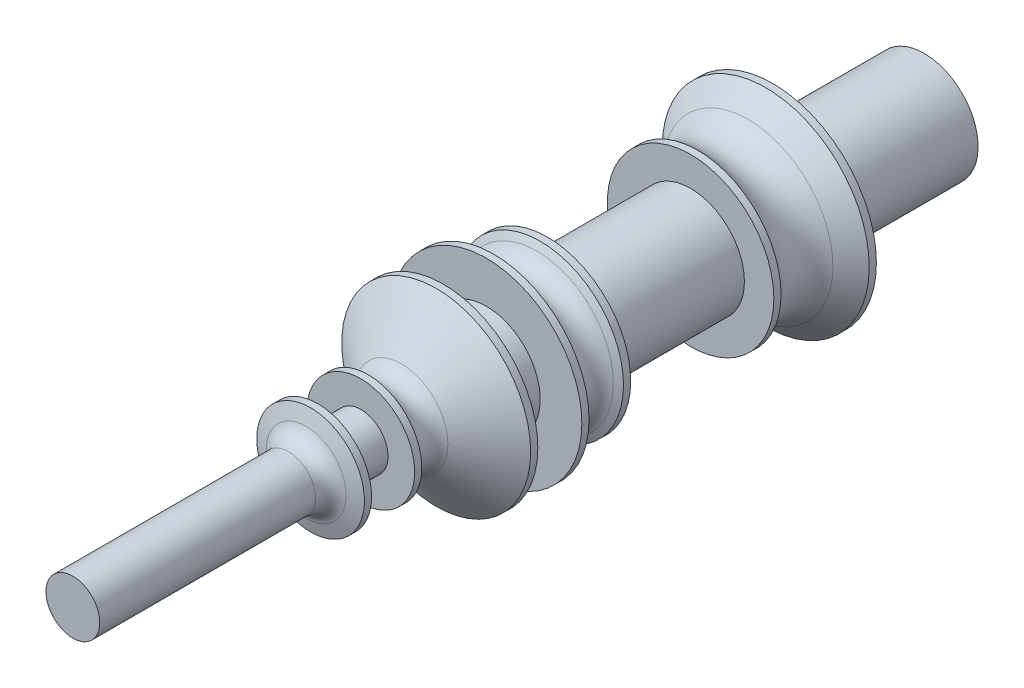
from build123d import *

# Parameters (mm, degrees)
SKETCH1_R           = 14.999999999999998
BOSS_EXTRUDE1_DEPTH = 235.00000000000006
FILLET2_R           = 10
SKETCH4_W           = 104.26000000000013
SKETCH4_H           = 22.69462593232808
SKETCH10_R          = 15
BOSS_EXTRUDE2_DEPTH = 10
SCALE1_SCALE        = 1.9329
BOSS_EXTRUDE3_START = 40
SKETCH11_R          = 28.993500000000004
BOSS_EXTRUDE3_DEPTH = 40
FILLET3_R           = 10
FILLET5_R           = 10
FILLET6_R           = 10
FILLET7_R           = 10
SCALE2_SCALE        = 1.5
SKETCH12_R          = 43.49025000000001
CUT_EXTRUDE1_DEPTH  = 33.369805
SKETCH13_R          = 43.49025000000001
CUT_EXTRUDE2_DEPTH  = 20


with BuildPart() as part:
    # Sketch1 → Boss-Extrude1 (new body)
    with BuildSketch(Plane.XY):
        Circle(SKETCH1_R)
    extrude(amount=BOSS_EXTRUDE1_DEPTH)

    # Sketch2 → Revolve1 (revolve)
    with BuildSketch(Plane(origin=(0, 0, 0), x_dir=(1, 0, 0), z_dir=(0, 1, 0))):
        Polygon((0, -112.54820823836592), (0, -13.4987966999347), (11.119928350948882, -13.4987966999347), (11.119928350948882, -39.9), (15.000000000000005, -39.9), (28.84535837615048, -39.89999999999999), (28.845358376150482, -41.9), (16.269055666837332, -53.905209320131334), (23.203846346706012, -60.84), (23.203846346706015, -62.84), (7.5, -62.84), (7.4999999999999964, -102.74), (23.203846346706012, -102.74), (23.203846346706012, -104.74), (7.499999999999994, -112.54820823836592), align=None)
    revolve(axis=Axis((0, 0, 112.54820823836592), (0, 0, -1)))

    # Fillet2
    # the kernel refuses this fillet: 10 mm, written as the material it adds along each edge
    with BuildSketch(Plane(origin=(0, 0, 53.905209320131334), x_dir=(1, 0, 0), z_dir=(0, 1, 0))) as fillet2_piece_1:
        with BuildLine():
            CenterArc((30.57076321680232, -0.17250291395021122), FILLET2_R, 133.66910726980632, 88.8805373351795)
            Line((23.665838203316056, 7.060892592873103), (23.527739703046333, 7.205560503009572))
            Line((23.527739703046333, 7.205560503009572), (16.130957166567608, 0.1446679101364694))
            Line((16.130957166567608, 0.1446679101364694), (16.127634310600023, -0.14142135623730923))
            ThreePointArc((16.127634310600023, -0.14142135623730923), (19.595029650534364, -3.608816696171644), (23.05650800930409, -7.070036435187042))
            Line((23.05650800930409, -7.070036435187042), (23.203846346706015, -6.934790679868669))
        make_face()
    revolve(axis=Axis((0, 0, 53.905209320131334), (0, 0, -1)))
    with BuildSketch(Plane(origin=(0, 0, 108.81908605423119), x_dir=(1, 2.8e-16, 0), z_dir=(-2.8e-16, 1, 0))) as fillet2_piece_2:
        with BuildLine():
            CenterArc((14.999999999999998 + FILLET2_R, -FILLET2_R * 0.619575560585), FILLET2_R, 116.43731334282423, 63.56268665717579)
            Line((14.999999999999998 + FILLET2_R * 0.554781591202, FILLET2_R * 0.275846445214), (14.999999999999998 + FILLET2_R * 0.545877223026, FILLET2_R * 0.293754885329))
            Line((14.999999999999998 + FILLET2_R * 0.545877223026, FILLET2_R * 0.293754885329), (14.999999999999998 - FILLET2_R * 0.02, FILLET2_R * 0.0123915112117))
            Line((14.999999999999998 - FILLET2_R * 0.02, FILLET2_R * 0.0123915112117), (14.999999999999998 - FILLET2_R * 0.02, -FILLET2_R * 0.619575560585))
            Line((14.999999999999998 - FILLET2_R * 0.02, -FILLET2_R * 0.619575560585), (15, -FILLET2_R * 0.619575560585))
        make_face()
    revolve(axis=Axis((0, 0, 108.81908605423119), (0, 0, -1)))

    # Sketch3 → Revolve2 (revolve)
    with BuildSketch(Plane(origin=(0, 0, 0), x_dir=(0, 0, -1), z_dir=(1, 0, 0)), mode=Mode.PRIVATE) as revolve2_sk:
        Polygon((-130.74, 0), (-130.73999999999998, 14), (-128.73999999999995, 14), (-119.92783449185274, 1.1e-14), align=None)
    revolve(revolve2_sk.sketch.rotate(Axis((0, 1.1e-14, 119.92783449185274), (0, -1.02e-15, 1)), 90), axis=Axis((0, 1.1e-14, 119.92783449185274), (0, -1.02e-15, 1)))

    # Sketch4 → Cut-Revolve1 (revolve, cut)
    with BuildSketch(Plane(origin=(0, 0, 0), x_dir=(0, 0, -1), z_dir=(1, 0, 0)), mode=Mode.PRIVATE) as cut_revolve1_sk:
        with Locations((-182.87, -18.84731296616404)):
            Rectangle(SKETCH4_W, SKETCH4_H)
    revolve(cut_revolve1_sk.sketch.rotate(Axis((0, 0, 235.00000000000006), (0, 0, -1)), 90), axis=Axis((0, 0, 235.00000000000006), (0, 0, -1)), mode=Mode.SUBTRACT)

    # Sketch6 → Revolve4 (revolve)
    with BuildSketch(Plane(origin=(0, 0, 0), x_dir=(1, 0, 0), z_dir=(0, 1, 0))):
        Polygon((1.514e-14, -147.73999999999998), (1.829e-14, -173.48215721635322), (-14.999999999999986, -168.74), (-14.999999999999986, -166.74), (-7.589567298836239, -166.74), (-7.589567298836239, -154.73999999999998), (-14.999999999999986, -154.73999999999998), (-14.999999999999982, -152.73999999999998), align=None)
    revolve(axis=Axis((1.514e-14, 0, 147.73999999999998), (1.2e-16, 0, 1)))

    # Sketch8 → Revolve5 (revolve)
    with BuildSketch(Plane(origin=(0, 0, 0), x_dir=(0, 0, -1), z_dir=(1, 0, 0)), mode=Mode.PRIVATE) as revolve5_sk:
        Polygon((-152.73999999999998, 0), (-103.74000000000001, 0), (-117.74, 26.59546670677199), (-119.74, 26.59546670677199), (-119.74, 7.34766847272492), (-131.74, 7.34766847272492), (-131.74, 26.32680255189654), (-133.74, 26.32680255189654), align=None)
    revolve(revolve5_sk.sketch.rotate(Axis((0, 0, 152.73999999999998), (0, 0, -1)), 90), axis=Axis((0, 0, 152.73999999999998), (0, 0, -1)))

    # Sketch10 → Boss-Extrude2 (add)
    with BuildSketch(Plane.XY.offset(130.73999999999992)):
        with Locations(Location((0, 0, 0), (0, 0, 180))):
            Circle(SKETCH10_R)
    extrude(amount=BOSS_EXTRUDE2_DEPTH)


with BuildPart() as part_1:
    # Scale1: scaled about (0, 0, 88.197821602)
    add(part.part.scale(SCALE1_SCALE).moved(Location((0, 0, -82.27974777250581))))

    # Sketch11 → Boss-Extrude3 (add)
    with BuildSketch(Plane(origin=(0, 0, -82.27974777267455), x_dir=(-1, 0, 0), z_dir=(0, 0, -1)).offset(BOSS_EXTRUDE3_START)):
        Circle(SKETCH11_R)
    extrude(amount=-BOSS_EXTRUDE3_DEPTH)

    # Fillet3
    fillet3_edges = [part_1.edges().sort_by_distance(p)[0] for p in [
        (-29.95619321315706, -5.5e-15, 134.00840315083104),
    ]]
    fillet(fillet3_edges, radius=FILLET3_R)

    # Fillet5
    fillet5_edges = [part_1.edges().sort_by_distance(p)[0] for p in [
        (14.496749999993185, 4.19492707e-09, 248.4608560692405),
    ]]
    fillet(fillet5_edges, radius=FILLET5_R)

    # Fillet6
    # the kernel refuses this fillet: 10 mm, written as the material it adds along each edge
    with BuildSketch(Plane(origin=(-2.381562e-11, -3.695293e-11, 208.1191482274964), x_dir=(-1.0, 2.5486940639204283e-12, 0), z_dir=(-2.5486940639204283e-12, -1.0, 0))) as fillet6_piece_1:
        with BuildLine():
            CenterArc((24.364379904655884, 7.2517155656861405), FILLET6_R, 189.3328180990746, 62.23223307800339)
            Line((14.496750000023814, 5.630025069564624), (14.299397401931174, 5.597591259642201))
            ThreePointArc((14.299397401931174, 5.597591259642201), (14.296750000023817, 2.815012534782312), (14.296749999976186, 0))
            Line((14.296749999976186, 0), (14.433504446772817, -0.1897366596101051))
            Line((14.433504446772817, -0.1897366596101051), (21.13885669128414, -2.4248540744291063))
            Line((21.13885669128414, -2.4248540744291063), (21.202102244487506, -2.235117414819001))
        make_face()
    revolve(axis=Axis((-2.381562e-11, -3.695293e-11, 208.1191482274964), (0, 0, -1)))

    # Fillet7
    # the kernel refuses this fillet: 10 mm, written as the material it adds along each edge
    with BuildSketch(Plane(origin=(0, 0, 202.48912315793177), x_dir=(1, 2.8e-16, 0), z_dir=(-2.8e-16, 1, 0))) as fillet7_piece_1:
        with BuildLine():
            CenterArc((30.840499091800684, -0.5370158996013572), FILLET7_R, 125.81790747161939, 125.7471437054586)
            Line((24.988387693610907, 7.571793642074738), (24.40317655379193, 8.382674596242339))
            Line((24.40317655379193, 8.382674596242339), (13.911538860181022, 0.810880954167601))
            Line((13.911538860181022, 0.810880954167601), (13.509987009536637, -0.16216904961120804))
            ThreePointArc((13.509987009536637, -0.16216904961120804), (20.885874478501762, -8.813825782452454), (27.36199366561547, -10.972532178157024))
            Line((27.36199366561547, -10.972532178157024), (27.678221431632306, -10.023848880106499))
        make_face()
    revolve(axis=Axis((0, 0, 202.48912315793177), (0, 0, -1)), revolution_arc=180)
    with BuildSketch(Plane(origin=(0, 0, 202.48912315793177), x_dir=(-1, -1.8e-16, 0), z_dir=(1.8e-16, -1, 0))) as fillet7_piece_2:
        with BuildLine():
            CenterArc((30.84049909180068, -0.5370158996013572), FILLET7_R, 125.81790747161942, 125.74714370545857)
            Line((24.988387693610896, 7.571793642074738), (24.40317655379192, 8.382674596242339))
            Line((24.40317655379192, 8.382674596242339), (13.911538860181022, 0.810880954167601))
            Line((13.911538860181022, 0.810880954167601), (13.509987009536832, -0.16216904961237333))
            ThreePointArc((13.509987009536832, -0.16216904961237333), (20.885874478435156, -8.813825782430257), (27.361993665615465, -10.972532178157024))
            Line((27.361993665615465, -10.972532178157024), (27.678221431632302, -10.023848880106499))
        make_face()
    revolve(axis=Axis((0, 0, 202.48912315793177), (0, 0, -1)), revolution_arc=180)


with BuildPart() as part_2:
    # Scale2: scaled about (1e-08, -3.6e-08, 74.121527206)
    add(part_1.part.scale(SCALE2_SCALE).moved(Location((-5e-09, 1.8e-08, -37.060763603))))

    # Sketch12 → Cut-Extrude1 (cut)
    with BuildSketch(Plane(origin=(0, 0, -220.4803849628567), x_dir=(-1, 0, 0), z_dir=(0, 0, -1))):
        Circle(SKETCH12_R)
    extrude(amount=-CUT_EXTRUDE1_DEPTH, mode=Mode.SUBTRACT)

    # Sketch13 → Cut-Extrude2 (cut)
    with BuildSketch(Plane(origin=(0, 0, -187.11057996285672), x_dir=(-1, 0, 0), z_dir=(0, 0, -1))):
        Circle(SKETCH13_R)
    extrude(amount=-CUT_EXTRUDE2_DEPTH, mode=Mode.SUBTRACT)


solid = part_2.part
